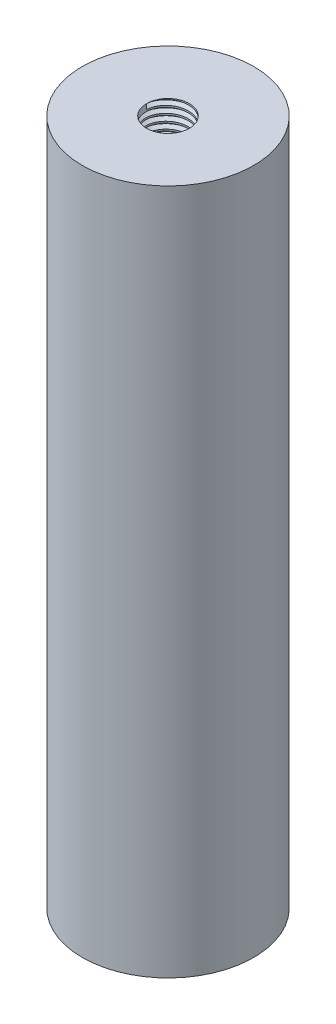
from build123d import *
from build123d.topology import SkipClean

# Parameters (mm, degrees)
SKETCH1_R           = 10
BOSS_EXTRUDE1_DEPTH = 80
SKETCH2_R           = 2.5
CUT_EXTRUDE1_DEPTH  = 20
CUT_EXTRUDE2_START  = -20
SKETCH3_R           = 2.5
CUT_EXTRUDE2_DEPTH  = 20
THREAD1_PITCH       = 0.8
THREAD2_PITCH       = 0.8


with BuildPart() as part:
    # Sketch1 → Boss-Extrude1 (new body)
    with BuildSketch(Plane(origin=(0, 0, 0), x_dir=(1, 0, 0), z_dir=(0, 1, 0))):
        with Locations(Location((0, 0, 0), (0, 0, 270))):
            Circle(SKETCH1_R)
    extrude(amount=BOSS_EXTRUDE1_DEPTH)

    # Sketch2 → Cut-Extrude1 (cut)
    with BuildSketch(Plane.XZ):
        with Locations(Location((0, 0, 0), (0, 0, 270))):
            Circle(SKETCH2_R)
    extrude(amount=-CUT_EXTRUDE1_DEPTH, mode=Mode.SUBTRACT)

    # Sketch3 → Cut-Extrude2 (cut)
    with BuildSketch(Plane(origin=(0, 80, 0), x_dir=(1, 0, 0), z_dir=(0, 1, 0)).offset(CUT_EXTRUDE2_START)):
        with Locations(Location((0, 0, 0), (0, 0, 90))):
            Circle(SKETCH3_R)
    extrude(amount=CUT_EXTRUDE2_DEPTH, mode=Mode.SUBTRACT)

    # Thread1: arcs per turn and ends read off the stored shape
    # Thread1: the profile of Thread Profile1 profile screwed along a right-hand helix through 25 turns, 8 arcs to a turn; built about Z, then put on its axis
    with SkipClean():  # the faces are left unmerged after this step: merging them gives an invalid solid
        thread1_z = Axis((0, 0, 0), (0, 0, 1))
        thread1_corners = [(2.4997, 0, -0.000173205), (2.9330127, 0, 0.249999999), (2.9330127, 0, 0.349999999), (2.4997, 0, 0.600173203)]
        with BuildLine(mode=Mode.PRIVATE) as thread1_profile:
            Line(thread1_corners[0], thread1_corners[1])
            Line(thread1_corners[1], thread1_corners[2])
            Line(thread1_corners[2], thread1_corners[3])
            Line(thread1_corners[3], thread1_corners[0])
        thread1_cap = Face(thread1_profile.wire())
        thread1_turn_angles = [0, 22.5, 45, 67.5, 90, 112.5, 135, 157.5, 180, 202.5, 225, 247.5, 270, 292.5, 315, 337.5, 360]
        thread1_turn_weights = [1, 0.9238795325112867, 1, 0.9238795325112867, 1, 0.9238795325112867, 1, 0.9238795325112867, 1, 0.9238795325112867, 1, 0.9238795325112867, 1, 0.9238795325112867, 1, 0.9238795325112867, 1]
        thread1_turn_rails = [Edge.make_bspline([Vector(p[0], p[1], 0).rotate(thread1_z, thread1_turn_angles[k]) / thread1_turn_weights[k] + Vector(0, 0, p[2] + THREAD1_PITCH * thread1_turn_angles[k] / 360) for k in range(17)], [0, 0, 0, 1, 1, 2, 2, 3, 3, 4, 4, 5, 5, 6, 6, 7, 7, 8, 8, 8], 2, thread1_turn_weights) for p in thread1_corners]
        thread1_turn_sides = [Face.make_surface_from_curves(thread1_turn_rails[p[0]], thread1_turn_rails[p[1]]) for p in [(0, 1), (1, 2), (2, 3), (3, 0)]]
        thread1 = Plane(origin=(0, 0, 0), x_dir=(1, 0, 0), z_dir=(0, 1, 0)) * Solid(Shell([*[p.moved(Location((0, 0, THREAD1_PITCH * i))) for i in range(25) for p in thread1_turn_sides], thread1_cap, thread1_cap.rotate(thread1_z, 9000).moved(Location((0, 0, THREAD1_PITCH * 9000 / 360)))]))
        add(thread1, mode=Mode.SUBTRACT)

    # Thread2: arcs per turn and ends read off the stored shape
    # Thread2: the profile of Thread Profile2 profile screwed along a right-hand helix through 25 turns, 8 arcs to a turn; built about Z, then put on its axis
    with SkipClean():  # the faces are left unmerged after this step: merging them gives an invalid solid
        thread2_z = Axis((0, 0, 0), (0, 0, 1))
        thread2_corners = [(2.4997, 0, -0.000173205), (2.9330127, 0, 0.249999999), (2.9330127, 0, 0.349999999), (2.4997, 0, 0.600173203)]
        with BuildLine(mode=Mode.PRIVATE) as thread2_profile:
            Line(thread2_corners[0], thread2_corners[1])
            Line(thread2_corners[1], thread2_corners[2])
            Line(thread2_corners[2], thread2_corners[3])
            Line(thread2_corners[3], thread2_corners[0])
        thread2_cap = Face(thread2_profile.wire())
        thread2_turn_angles = [0, 22.5, 45, 67.5, 90, 112.5, 135, 157.5, 180, 202.5, 225, 247.5, 270, 292.5, 315, 337.5, 360]
        thread2_turn_weights = [1, 0.9238795325112867, 1, 0.9238795325112867, 1, 0.9238795325112867, 1, 0.9238795325112867, 1, 0.9238795325112867, 1, 0.9238795325112867, 1, 0.9238795325112867, 1, 0.9238795325112867, 1]
        thread2_turn_rails = [Edge.make_bspline([Vector(p[0], p[1], 0).rotate(thread2_z, thread2_turn_angles[k]) / thread2_turn_weights[k] + Vector(0, 0, p[2] + THREAD2_PITCH * thread2_turn_angles[k] / 360) for k in range(17)], [0, 0, 0, 1, 1, 2, 2, 3, 3, 4, 4, 5, 5, 6, 6, 7, 7, 8, 8, 8], 2, thread2_turn_weights) for p in thread2_corners]
        thread2_turn_sides = [Face.make_surface_from_curves(thread2_turn_rails[p[0]], thread2_turn_rails[p[1]]) for p in [(0, 1), (1, 2), (2, 3), (3, 0)]]
        thread2 = Plane(origin=(0, 80, 0), x_dir=(-1, 0, 0), z_dir=(0, -1, 0)) * Solid(Shell([*[p.moved(Location((0, 0, THREAD2_PITCH * i))) for i in range(25) for p in thread2_turn_sides], thread2_cap, thread2_cap.rotate(thread2_z, 9000).moved(Location((0, 0, THREAD2_PITCH * 9000 / 360)))]))
        add(thread2, mode=Mode.SUBTRACT)


solid = part.part
